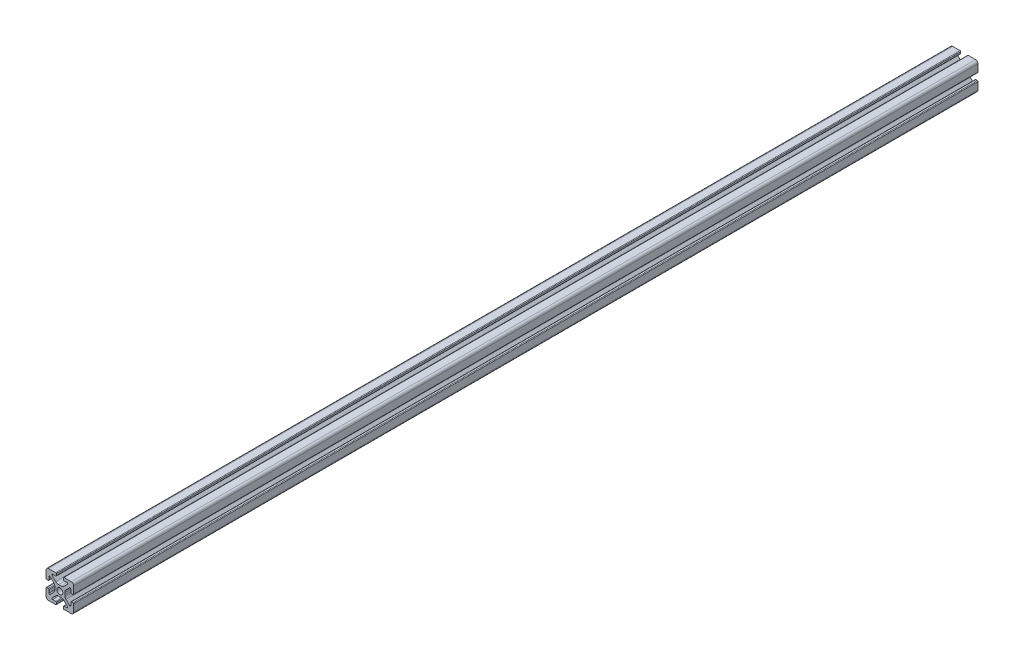
from build123d import *

# Parameters (mm, degrees)
BOSS_EXTRUDE1_DEPTH = 327.25


with BuildPart() as part:
    # Sketch4 → Boss-Extrude1 (new, symmetric)
    with BuildSketch(Plane.XY):
        with BuildLine():
            Line((3, -10), (8.25, -10))
            ThreePointArc((8.25, -10), (9.487436867, -9.487436867), (10, -8.25))
            Line((10, -8.25), (10, -3))
            ThreePointArc((10, -3), (9.853553391, -2.646446609), (9.5, -2.5))
            Line((9.5, -2.5), (8.424621202, -2.5))
            ThreePointArc((8.424621202, -2.5), (8.071067812, -2.646446609), (7.924621202, -3))
            Line((7.924621202, -3), (7.924621202, -5.25))
            ThreePointArc((7.924621202, -5.25), (7.615962919, -5.711939766), (7.071067812, -5.603553391))
            Line((7.071067812, -5.603553391), (4.478679656, -3.011165235))
            ThreePointArc((4.478679656, -3.011165235), (3.828361402, -2.037895189), (3.6, -0.889844892))
            Line((3.6, -0.889844892), (3.6, 0))
            Line((3.6, 0), (2.15, 0))
            ThreePointArc((2.15, 0), (1.52027958, -1.52027958), (0, -2.15))
            Line((0, -2.15), (0, -3.6))
            Line((0, -3.6), (0.889844892, -3.6))
            ThreePointArc((0.889844892, -3.6), (2.037895189, -3.828361402), (3.011165235, -4.478679656))
            Line((3.011165235, -4.478679656), (5.603553391, -7.071067812))
            ThreePointArc((5.603553391, -7.071067812), (5.711939766, -7.615962919), (5.25, -7.924621202))
            Line((5.25, -7.924621202), (3, -7.924621202))
            ThreePointArc((3, -7.924621202), (2.646446609, -8.071067812), (2.5, -8.424621202))
            Line((2.5, -8.424621202), (2.5, -9.5))
            ThreePointArc((2.5, -9.5), (2.646446609, -9.853553391), (3, -10))
        make_face()
    extrude(amount=BOSS_EXTRUDE1_DEPTH, both=True)

    # Mirror1: part across plane


with BuildPart() as part_1:
    add(part.part)
    add(part.part.mirror(Plane(origin=(0, 0, 0), x_dir=(0, 0, 1), z_dir=(1, 0, 0))))

    # Mirror2: part across plane


with BuildPart() as part_2:
    add(part_1.part)
    add(part_1.part.mirror(Plane.ZX))


solid = part_2.part
